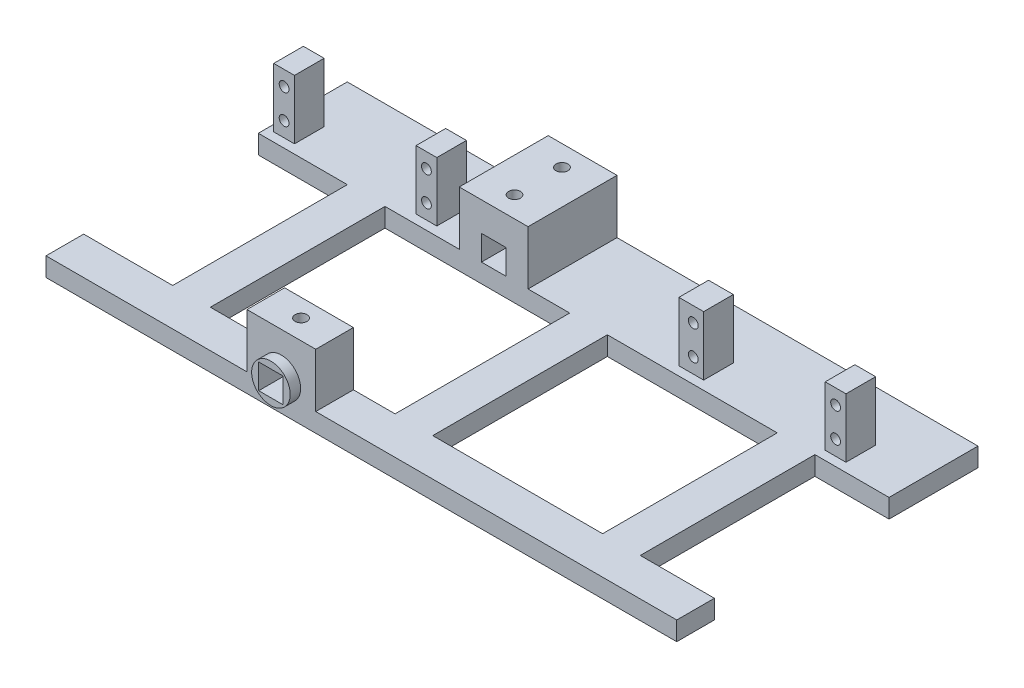
from build123d import *

# Parameters (mm, degrees)
SKETCH1_W           = 57.3
SKETCH1_H           = 58.9
SKETCH1_W_2         = 62.3
BOSS_EXTRUDE1_DEPTH = 6.35
SKETCH6_W           = 7
SKETCH6_H           = 10
SKETCH6_W_2         = 8.35
BOSS_EXTRUDE5_DEPTH = 20
SKETCH7_R           = 1.65
CUT_EXTRUDE1_DEPTH  = 227.961248069
BOSS_EXTRUDE6_DEPTH = 30
SKETCH10_W          = 23.2
SKETCH10_H          = 17.3
CUT_EXTRUDE2_DEPTH  = 237.589276226
SKETCH11_R          = 6.5
BOSS_EXTRUDE7_DEPTH = 2
SKETCH12_R          = 6.5
BOSS_EXTRUDE8_DEPTH = 1.525
SKETCH17_R          = 2
CUT_EXTRUDE6_DEPTH  = 239.54956246


with BuildPart() as part:
    # Sketch1 → Boss-Extrude1 (new body)
    with BuildSketch(Plane(origin=(0, 0, 0), x_dir=(1, 0, 0), z_dir=(0, 1, 0))):
        Polygon((0, 101.6), (0, 71.6), (30.025, 71.6), (30.025, 12.7), (0, 12.7), (0, 0), (212.725, 0), (212.725, 12.7), (187.725, 12.7), (187.725, 71.6), (212.725, 71.6), (212.725, 101.6), align=None)
        with Locations((146.375, 42.15)):
            Rectangle(SKETCH1_W, SKETCH1_H, mode=Mode.SUBTRACT)
        with Locations((73.875, 42.15)):
            Rectangle(SKETCH1_W_2, SKETCH1_H, mode=Mode.SUBTRACT)
    extrude(amount=BOSS_EXTRUDE1_DEPTH)

    # Sketch6 → Boss-Extrude5 (add)
    with BuildSketch(Plane(origin=(0, 6.35, 0), x_dir=(1, 0, 0), z_dir=(0, 1, 0))):
        with Locations((191.7, 79.6)):
            Rectangle(SKETCH6_W, SKETCH6_H)
        with Locations((143.025, 79.6)):
            Rectangle(SKETCH6_W_2, SKETCH6_H)
        with Locations((53.7, 79.6)):
            Rectangle(SKETCH6_W, SKETCH6_H)
        with Locations((5.7, 79.6)):
            Rectangle(SKETCH6_W, SKETCH6_H)
    extrude(amount=BOSS_EXTRUDE5_DEPTH)

    # Sketch7 → Cut-Extrude1 (cut, through all)
    with BuildSketch(Plane.XY.offset(-74.6)):
        with Locations((191.7, 21.3)):
            Circle(SKETCH7_R)
        with Locations((191.7, 11.4)):
            Circle(SKETCH7_R)
        with Locations((143.7, 11.4)):
            Circle(SKETCH7_R)
        with Locations((143.7, 21.3)):
            Circle(SKETCH7_R)
        with Locations((86, 21.3)):
            Circle(SKETCH7_R)
        with Locations((86, 11.4)):
            Circle(SKETCH7_R)
        with Locations((134, 21.3)):
            Circle(SKETCH7_R)
        with Locations((134, 11.4)):
            Circle(SKETCH7_R)
        with Locations((5.7, 21.3)):
            Circle(SKETCH7_R)
        with Locations((5.7, 11.4)):
            Circle(SKETCH7_R)
        with Locations((53.7, 11.4)):
            Circle(SKETCH7_R)
        with Locations((53.7, 21.3)):
            Circle(SKETCH7_R)
    extrude(amount=-CUT_EXTRUDE1_DEPTH, mode=Mode.SUBTRACT)

    # Sketch9 → Boss-Extrude6 (add)
    with BuildSketch(Plane(origin=(0, 0, -101.6), x_dir=(-1, 0, 0), z_dir=(0, 0, -1))):
        Polygon((-83.475, 6.35), (-83.475, 14.75), (-75.275, 14.75), (-75.275, 6.35), (-67.775, 6.35), (-67.775, 24.55), (-90.975, 24.55), (-90.975, 6.35), align=None)
    boss_extrude6 = extrude(amount=-BOSS_EXTRUDE6_DEPTH)

    # Mirror1: Boss-Extrude6 across plane
    add(boss_extrude6.mirror(Plane(origin=(0, 0, -50.8), x_dir=(1, 0, 0), z_dir=(0, 0, -1))))

    # Sketch10 → Cut-Extrude2 (cut, through all)
    with BuildSketch(Plane(origin=(0, 6.35, 0), x_dir=(-1, 0, 0), z_dir=(0, -1, 0))):
        with Locations((-79.375, 21.35)):
            Rectangle(SKETCH10_W, SKETCH10_H)
    extrude(amount=-CUT_EXTRUDE2_DEPTH, mode=Mode.SUBTRACT)

    # Sketch11 → Boss-Extrude7 (add)
    with BuildSketch(Plane(origin=(0, 0, -101.6), x_dir=(-1, 0, 0), z_dir=(0, 0, -1))):
        with Locations((-79.375, 10.55)):
            Circle(SKETCH11_R)
        Polygon((-83.475, 14.75), (-79.375, 14.75), (-75.275, 14.75), (-75.275, 6.35), (-79.375, 6.35), (-83.475, 6.35), align=None, mode=Mode.SUBTRACT)
    boss_extrude7 = extrude(amount=BOSS_EXTRUDE7_DEPTH)

    # Sketch12 → Boss-Extrude8 (add)
    with BuildSketch(Plane(origin=(0, 0, -103.6), x_dir=(-1, 0, 0), z_dir=(0, 0, -1))):
        with Locations((-79.375, 10.55)):
            Circle(SKETCH12_R)
        Polygon((-83.475, 14.75), (-79.375, 14.75), (-75.275, 14.75), (-75.275, 6.35), (-79.375, 6.35), (-83.475, 6.35), align=None, mode=Mode.SUBTRACT)
    boss_extrude8 = extrude(amount=BOSS_EXTRUDE8_DEPTH)

    # Mirror2: Boss-Extrude7, Boss-Extrude8 across plane
    add(boss_extrude7.mirror(Plane(origin=(0, 0, -50.8), x_dir=(1, 0, 0), z_dir=(0, 0, -1))))
    add(boss_extrude8.mirror(Plane(origin=(0, 0, -50.8), x_dir=(1, 0, 0), z_dir=(0, 0, -1))))

    # Sketch17 → Cut-Extrude6 (cut, through all)
    with BuildSketch(Plane(origin=(0, 24.55, 0), x_dir=(1, 0, 0), z_dir=(0, 1, 0))):
        with Locations((79.375, 94.6355)):
            Circle(SKETCH17_R)
        with Locations((79.375, 6.6355)):
            Circle(SKETCH17_R)
        with Locations((79.375, 78.6355)):
            Circle(SKETCH17_R)
    extrude(amount=-CUT_EXTRUDE6_DEPTH, mode=Mode.SUBTRACT)


solid = part.part
